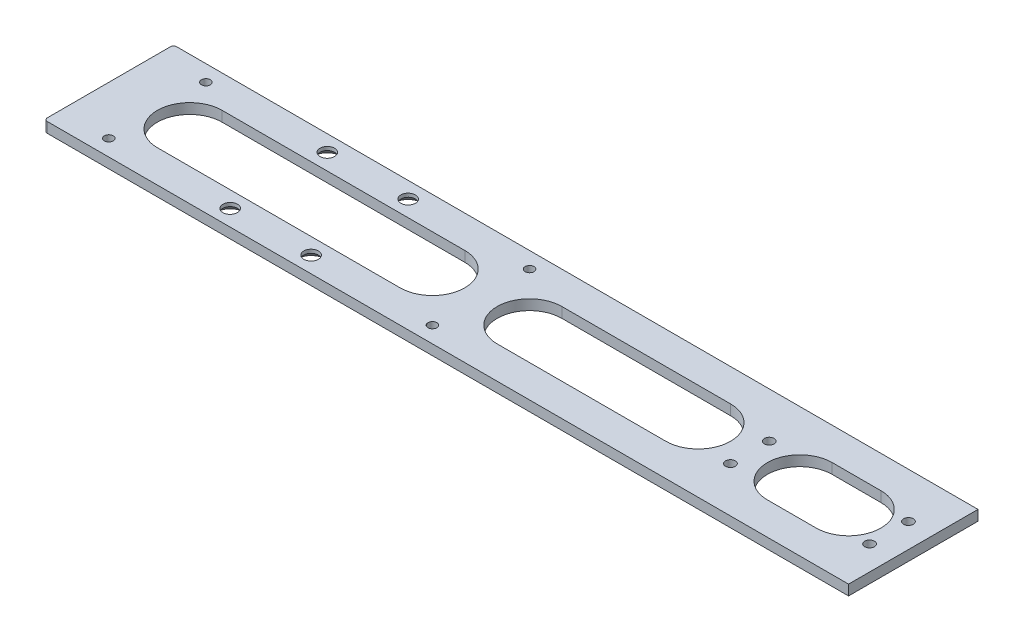
from build123d import *

# Parameters (mm, degrees)
CROQUIS1_W                                      = 497.15
CROQUIS1_H                                      = 80
BRIDA_BASE1_DEPTH                               = 6.35
REDONDEO1_R                                     = 2
TALADRO_DE_MARGEN_PARA_M51_D                    = 5.5
CORTAR_EXTRUIR1_DEPTH                           = 10
CROQUIS10_R                                     = 3
CORTAR_EXTRUIR2_DEPTH                           = 10
SKETCH1_R                                       = 4.5
CUT_EXTRUDE1_DEPTH                              = 6.35
CSK_FOR_M8_OVAL_HEAD_MACHINE_SCREW1_D           = 9
CSK_FOR_M8_OVAL_HEAD_MACHINE_SCREW1_DEPTH       = 6.349
CSK_FOR_M8_OVAL_HEAD_MACHINE_SCREW1_CSINK_D     = 17.3
CSK_FOR_M8_OVAL_HEAD_MACHINE_SCREW1_CSINK_ANGLE = 90
CSK_FOR_M8_OVAL_HEAD_MACHINE_SCREW1_TIP         = 2.703872786


# Sheet-metal steps are written as plain solids
with BuildPart() as part:
    # Croquis1 → Brida base1 (new body)
    with BuildSketch(Plane(origin=(0, 0, 0), x_dir=(1, 0, 0), z_dir=(0, 1, 0))):
        with Locations((98.797222222, -5.555555556)):
            Rectangle(CROQUIS1_W, CROQUIS1_H)
    extrude(amount=-BRIDA_BASE1_DEPTH)

    # Redondeo1
    redondeo1_edges = [part.edges().sort_by_distance(p)[0] for p in [
        (-149.777777778, -3.175, -34.444444444),
        (-149.777777778, -3.175, 45.555555556),
    ]]
    fillet(redondeo1_edges, radius=REDONDEO1_R)

    # Taladro de margen para M51 (through all)
    with Locations(Plane(origin=(0, 0, 0), x_dir=(1, 0, 0), z_dir=(0, 1, 0))):
        with Locations((-119.777777778, 24.444444444), (-119.777777778, -35.555555556), (80.222222222, -35.555555556), (80.222222222, 24.444444444)):
            Hole(TALADRO_DE_MARGEN_PARA_M51_D / 2)

    # Croquis9 → Cortar-Extruir1 (cut)
    with BuildSketch(Plane(origin=(0, -6.35, 0), x_dir=(-1, 0, 0), z_dir=(0, -1, 0))):
        with BuildLine():
            Line((-307.372222222, 14.444444444), (-277.234752083, 14.444444444))
            ThreePointArc((-277.234752083, 14.444444444), (-257.234752083, -5.555555556), (-277.234752083, -25.555555556))
            Line((-277.234752083, -25.555555556), (-307.372222222, -25.555555556))
            ThreePointArc((-307.372222222, -25.555555556), (-327.372222222, -5.555555556), (-307.372222222, 14.444444444))
        make_face()
        with BuildLine():
            Line((-50.222222222, 14.444444444), (99.777777778, 14.444444444))
            ThreePointArc((99.777777778, 14.444444444), (119.777777778, -5.555555556), (99.777777778, -25.555555556))
            Line((99.777777778, -25.555555556), (-50.222222222, -25.555555556))
            ThreePointArc((-50.222222222, -25.555555556), (-70.222222222, -5.555555556), (-50.222222222, 14.444444444))
        make_face()
        with BuildLine():
            Line((-214.481912447, 14.444444444), (-110.222222222, 14.444444444))
            ThreePointArc((-110.222222222, 14.444444444), (-90.222222222, -5.555555556), (-110.222222222, -25.555555556))
            Line((-110.222222222, -25.555555556), (-214.481912447, -25.555555556))
            ThreePointArc((-214.481912447, -25.555555556), (-234.481912447, -5.555555556), (-214.481912447, 14.444444444))
        make_face()
    extrude(amount=-CORTAR_EXTRUIR1_DEPTH, mode=Mode.SUBTRACT)

    # Croquis10 → Cortar-Extruir2 (cut)
    with BuildSketch(Plane.XZ.offset(6.35)):
        with Locations(Location((332.372222222, 17.555555556, 0), (0, 0, 270))):
            Circle(CROQUIS10_R)
        with Locations(Location((246.372222222, 17.555555556, 0), (0, 0, 270))):
            Circle(CROQUIS10_R)
        with Locations(Location((246.372222222, -6.444444444, 0), (0, 0, 270))):
            Circle(CROQUIS10_R)
        with Locations(Location((332.372222222, -6.444444444, 0), (0, 0, 270))):
            Circle(CROQUIS10_R)
    extrude(amount=-CORTAR_EXTRUIR2_DEPTH, mode=Mode.SUBTRACT)

    # Sketch1 → Cut-Extrude1 (cut)
    with BuildSketch(Plane.XZ.offset(6.35)):
        with Locations(Location((-44.777777778, -24.444444444, 0), (0, 0, 270))):
            Circle(SKETCH1_R)
        with Locations(Location((5.222222222, -24.444444444, 0), (0, 0, 270))):
            Circle(SKETCH1_R)
        with Locations(Location((5.222222222, 35.555555556, 0), (0, 0, 270))):
            Circle(SKETCH1_R)
        with Locations(Location((-44.777777778, 35.555555556, 0), (0, 0, 90))):
            Circle(SKETCH1_R)
    extrude(amount=-CUT_EXTRUDE1_DEPTH, mode=Mode.SUBTRACT)

    # CSK for M8 Oval Head Machine Screw1
    with Locations(Plane(origin=(5.222222222, -6.35, 35.555555556), x_dir=(0, 0, -1), z_dir=(0, -1, 0))):
        with Locations((0, 0), (0, -50), (60, -50), (60, 0)):
            CounterSinkHole(CSK_FOR_M8_OVAL_HEAD_MACHINE_SCREW1_D / 2, CSK_FOR_M8_OVAL_HEAD_MACHINE_SCREW1_CSINK_D / 2, depth=CSK_FOR_M8_OVAL_HEAD_MACHINE_SCREW1_DEPTH, counter_sink_angle=CSK_FOR_M8_OVAL_HEAD_MACHINE_SCREW1_CSINK_ANGLE)
            with Locations((0, 0, -(CSK_FOR_M8_OVAL_HEAD_MACHINE_SCREW1_DEPTH + CSK_FOR_M8_OVAL_HEAD_MACHINE_SCREW1_TIP / 2))):  # 118° drill point
                Cone(0, CSK_FOR_M8_OVAL_HEAD_MACHINE_SCREW1_D / 2, CSK_FOR_M8_OVAL_HEAD_MACHINE_SCREW1_TIP, mode=Mode.SUBTRACT)


solid = part.part
